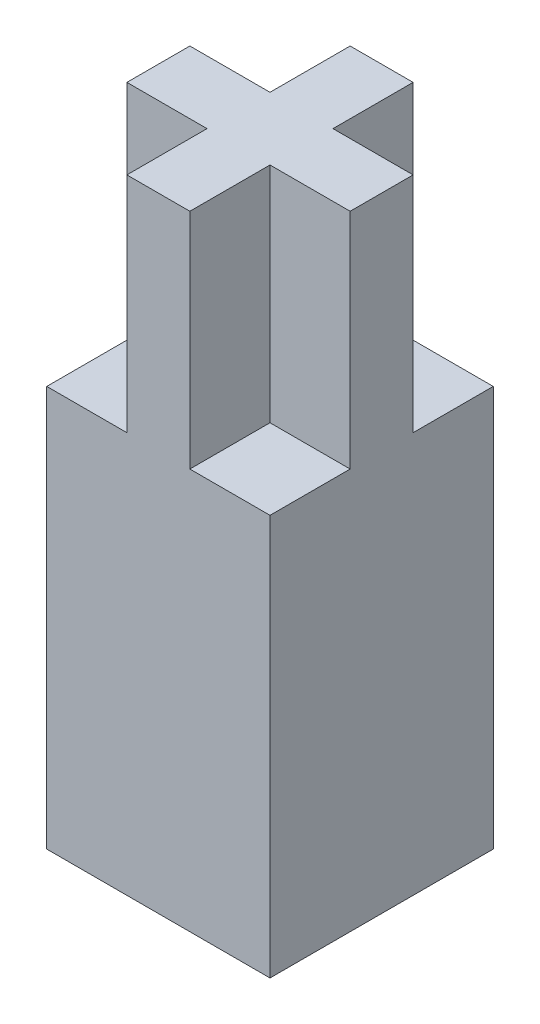
from build123d import *

# Parameters (mm, degrees)
SKETCH_5_W      = 1.1
SKETCH_5_H      = 3.9
SKETCH_5_W_2    = 3.9
SKETCH_5_H_2    = 1.1
EXTRUDE_1_DEPTH = 3.9
SKETCH_6_W      = 3.9
SKETCH_6_H      = 3.9
EXTRUDE_2_DEPTH = 7


with BuildPart() as part:
    # 草图5 → 凸台-拉伸1 (new body)
    with BuildSketch(Plane(origin=(0, 0, 0), x_dir=(-1, 0, 0), z_dir=(0, 1, 0))):
        Rectangle(SKETCH_5_W, SKETCH_5_H)
        Rectangle(SKETCH_5_W_2, SKETCH_5_H_2)
    extrude(amount=EXTRUDE_1_DEPTH)

    # 草图6 → 凸台-拉伸2 (add)
    with BuildSketch(Plane.XZ):
        Rectangle(SKETCH_6_W, SKETCH_6_H)
    extrude(amount=EXTRUDE_2_DEPTH)


solid = part.part
